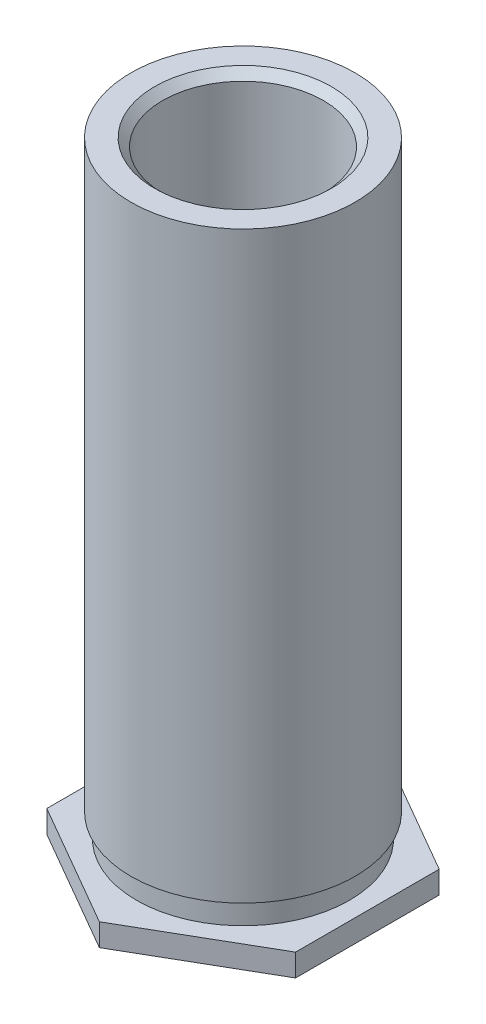
from build123d import *

# Parameters (mm, degrees)
HEXDIESKE_R  = 4.5825
HEXDIE_DEPTH = 0.712


with BuildPart() as part:
    # BodySke → Body (revolve)
    with BuildSketch(Plane.XY):
        Polygon((3.56, 0), (4.582, 0), (4.582, 0.712), (3.382, 0.712), (3.382, 1.4596), (3.56, 1.4596), (3.56, 20), (2.805, 20), (2.55, 19.745), (2.55, 0.26008), (2.805, 0.00508), (3.56, 0.00508), align=None)
    revolve(axis=Axis((0, 0, 0), (0, 1, 0)))

    # HexDieSke → HexDie (cut)
    with BuildSketch(Plane(origin=(0, 0.712, 0), x_dir=(-1, 0, 0), z_dir=(0, 1, 0))):
        Circle(HEXDIESKE_R)
        Polygon((0, 4.561067127), (3.95, 2.280533563), (3.95, -2.280533563), (0, -4.561067127), (-3.95, -2.280533563), (-3.95, 2.280533563), align=None, mode=Mode.SUBTRACT)
    extrude(amount=-HEXDIE_DEPTH, mode=Mode.SUBTRACT)


solid = part.part
